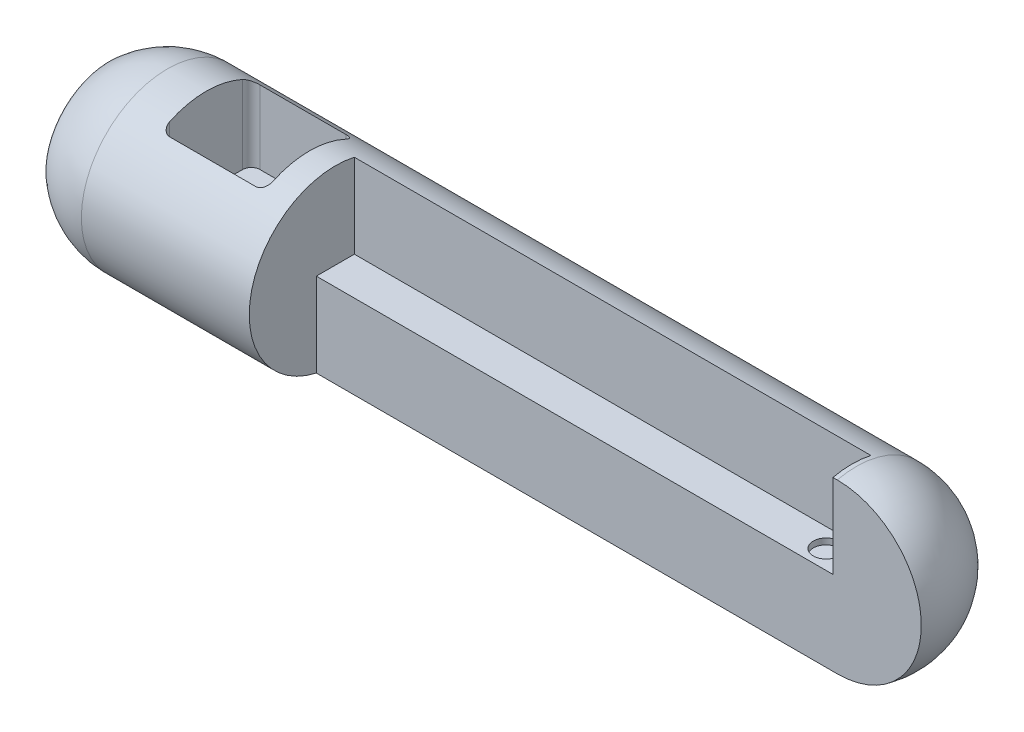
from build123d import *

# Parameters (mm, degrees)
CUT_EXTRUDE7_DEPTH               = 1010.950493836
CUT_EXTRUDE7_DEPTH_BACK          = 1010.950493836
SKETCH13_W                       = 48.176434887
SKETCH13_H                       = 155.804640487
SKETCH4_W                        = 600
SKETCH4_H                        = 44.158972604
CUT_EXTRUDE2_DEPTH               = 1010.950493836
SKETCH7_W                        = 159.807953253
SKETCH7_H                        = 69.49104999
BOSS_EXTRUDE7_DEPTH              = 5
FILLET5_R                        = 10
F_5_8_0_625_DIAMETER_HOLE1_D     = 15.875
F_5_8_0_625_DIAMETER_HOLE1_DEPTH = 30
F_5_8_0_625_DIAMETER_HOLE1_TIP   = 4.769331164
BOSS_EXTRUDE8_DEPTH              = 10
BOSS_EXTRUDE8_DEPTH_BACK         = 10
SKETCH16_W                       = 57.403477863
SKETCH16_H                       = 23.203595883
SKETCH17_W                       = 38.256761469
SKETCH17_H                       = 12.64819079
BOSS_EXTRUDE9_DEPTH              = 10
SKETCH18_W                       = 120
SKETCH18_H                       = 104.74536306
CUT_EXTRUDE8_DEPTH               = 161
FILLET6_R                        = 10
SKETCH19_R                       = 15
CUT_EXTRUDE9_DEPTH               = 7
CUT_EXTRUDE11_DEPTH              = 1010.950493856
CUT_EXTRUDE11_DEPTH_BACK         = 1010.950493856
SKETCH22_W                       = 1481.455902665
SKETCH22_H                       = 524.99926461


# Read off the part's stored shape, not the designer's step: Revolve1
with BuildPart() as part:
    # Revolve1 outline → Revolve1 (revolve)
    with BuildSketch(Plane.YX):
        with BuildLine():
            Line((0, 1000), (0, 0))
            ThreePointArc((0, 0), (70.710678154, 29.289321917), (100, 100.0000001))
            Line((100, 100.0000001), (100, 899.9999999))
            ThreePointArc((100, 899.9999999), (70.710678154, 970.710678083), (0, 1000))
        make_face()
    revolve(axis=Axis((0, 0, 0), (1, 0, 0)))

    # Sketch13 → Cut-Extrude7 (cut, two sides: drawn at the far end of the back side and taken through both)
    with BuildSketch(Plane(origin=(0, 0, 0), x_dir=(1, 0, 0), z_dir=(0, 1, 0)).offset(-CUT_EXTRUDE7_DEPTH_BACK)):
        with Locations((5.911782557, -3.075091589)):
            Rectangle(SKETCH13_W, SKETCH13_H)
    extrude(amount=CUT_EXTRUDE7_DEPTH + CUT_EXTRUDE7_DEPTH_BACK, mode=Mode.SUBTRACT)

    # Sketch4 → Cut-Extrude2 (cut, through all)
    with BuildSketch(Plane(origin=(0, 0, 0), x_dir=(1, 0, 0), z_dir=(0, 1, 0))):
        with Locations((595, 0)):
            Rectangle(SKETCH4_W, SKETCH4_H)
    extrude(amount=CUT_EXTRUDE2_DEPTH, mode=Mode.SUBTRACT)

    # Sketch7 → Boss-Extrude7 (add)
    with BuildSketch(Plane(origin=(0, 0, 0), x_dir=(1, 0, 0), z_dir=(0, 1, 0))):
        with Locations((745.885521462, -1.405844332)):
            Rectangle(SKETCH7_W, SKETCH7_H)
    extrude(amount=-BOSS_EXTRUDE7_DEPTH)

    # Fillet5
    fillet5_edges = [part.edges().sort_by_distance(p)[0] for p in [
        (30, -71.414284286, 0),
    ]]
    fillet(fillet5_edges, radius=FILLET5_R)

    # 5/8 (0.625) Diameter Hole1
    with Locations(Plane.ZY.offset(-30)):
        with Locations((0, 0)):
            Hole(F_5_8_0_625_DIAMETER_HOLE1_D / 2, depth=F_5_8_0_625_DIAMETER_HOLE1_DEPTH)
            with Locations((0, 0, -(F_5_8_0_625_DIAMETER_HOLE1_DEPTH + F_5_8_0_625_DIAMETER_HOLE1_TIP / 2))):  # 118° drill point
                Cone(0, F_5_8_0_625_DIAMETER_HOLE1_D / 2, F_5_8_0_625_DIAMETER_HOLE1_TIP, mode=Mode.SUBTRACT)

    # Sketch16 → Boss-Extrude8 (add, two sides: drawn at the far end of the back side and taken through both)
    with BuildSketch(Plane.XY.offset(-BOSS_EXTRUDE8_DEPTH_BACK)):
        with Locations((738.294537666, -11.601797942)):
            Rectangle(SKETCH16_W, SKETCH16_H)
    extrude(amount=BOSS_EXTRUDE8_DEPTH + BOSS_EXTRUDE8_DEPTH_BACK)

    # Sketch17 → Boss-Extrude9 (add)
    with BuildSketch(Plane.XY.offset(-22.079486302)):
        with Locations((787.071835847, 6.324095395)):
            Rectangle(SKETCH17_W, SKETCH17_H)
    extrude(amount=-BOSS_EXTRUDE9_DEPTH)

    # Sketch18 → Cut-Extrude8 (cut)
    with BuildSketch(Plane(origin=(0, 0, 0), x_dir=(1, 0, 0), z_dir=(0, 1, 0))):
        with Locations((204.992275313, 0)):
            Rectangle(SKETCH18_W, SKETCH18_H)
    extrude(amount=CUT_EXTRUDE8_DEPTH, mode=Mode.SUBTRACT)

    # Fillet6
    fillet6_edges = [part.edges().sort_by_distance(p)[0] for p in [
        (144.992275313, 42.594313674, -52.37268153),
        (144.992275313, 42.594313674, 52.37268153),
        (264.992275313, 42.594313674, 52.37268153),
        (264.992275313, 42.594313674, -52.37268153),
    ]]
    fillet(fillet6_edges, radius=FILLET6_R)

    # Sketch19 → Cut-Extrude9 (cut)
    with BuildSketch(Plane(origin=(0, 0, 0), x_dir=(1, 0, 0), z_dir=(0, 1, 0))):
        with Locations(Location((865, 0, 0), (0, 0, 270))):
            Circle(SKETCH19_R)
    extrude(amount=-CUT_EXTRUDE9_DEPTH, mode=Mode.SUBTRACT)

    # Sketch22 → Cut-Extrude11 (cut, two sides: drawn at the far end of the back side and taken through both)
    with BuildSketch(Plane(origin=(0, 0, 0), x_dir=(1, 0, 0), z_dir=(0, 1, 0)).offset(-CUT_EXTRUDE11_DEPTH_BACK)):
        with Locations((406.155110175, 0)):
            Rectangle(SKETCH22_W, SKETCH22_H)
        Polygon((-101.289974143, 163.942834617), (1092.059469606, 163.942834617), (1092.059469606, -22.079486302), (295, -22.079486302), (295, -179.828704734), (-101.289974143, -179.828704734), (-101.289974143, -22.079486302), align=None, mode=Mode.SUBTRACT)
    extrude(amount=CUT_EXTRUDE11_DEPTH + CUT_EXTRUDE11_DEPTH_BACK, mode=Mode.SUBTRACT)


solid = part.part
